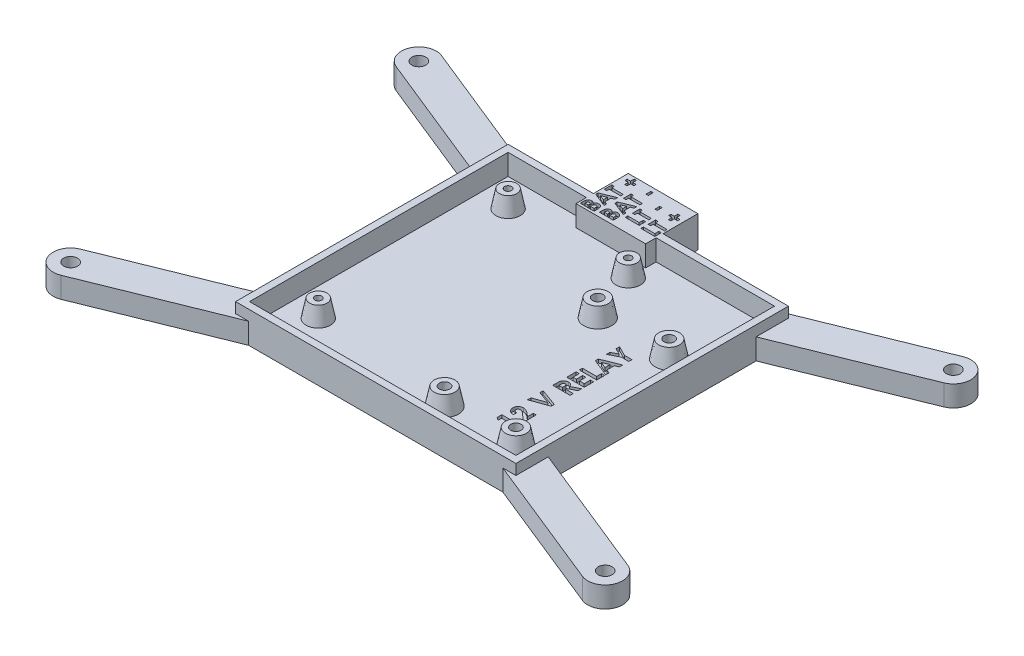
from build123d import *
from build123d.topology import SkipClean

# Parameters (mm, degrees)
SKETCH1_W           = 80.5
SKETCH1_H           = 78.25
SKETCH1_R           = 3
SKETCH1_R_2         = 2.5
SKETCH1_R_3         = 1
SKETCH1_R_4         = 1.5
BOSS_EXTRUDE1_DEPTH = 3
SKETCH1_3_R         = 2.5
SKETCH1_3_R_2       = 1
SKETCH1_3_R_3       = 3
SKETCH1_3_R_4       = 1.5
BOSS_EXTRUDE2_DEPTH = 5
CHAMFER1_SIZE       = 1
CHAMFER1_SIZE_2     = 5
SKETCH2_R           = 5
SKETCH2_R_2         = 2
BOSS_EXTRUDE3_DEPTH = 3
SKETCH3_W           = 80.5
SKETCH3_H           = 78.25
SKETCH3_W_2         = 76.5
SKETCH3_H_2         = 74.25
BOSS_EXTRUDE4_DEPTH = 6
BOSS_EXTRUDE5_START = 3
SKETCH4_R           = 2.5
BOSS_EXTRUDE5_DEPTH = 3
BOSS_EXTRUDE6_REACH = 140.149
SKETCH5_W           = 20
SKETCH5_H           = 15
SKETCH6_W           = 0.666666667
SKETCH6_H           = 1.384615384
SKETCH6_H_2         = 1.384615385
CUT_EXTRUDE1_DEPTH  = 1
CUT_EXTRUDE2_DEPTH  = 1


with BuildPart() as part:
    # Sketch1 → Boss-Extrude1 (new body)
    # profile 1 of 17: a face of its own
    with BuildSketch(Plane(origin=(0, 0, 0), x_dir=(1, 0, 0), z_dir=(0, 1, 0))):
        with Locations((30.25, 25.375)):
            Rectangle(SKETCH1_W, SKETCH1_H)
        with Locations((60.5, 40.25)):
            Circle(SKETCH1_R, mode=Mode.SUBTRACT)
        Circle(SKETCH1_R_2, mode=Mode.SUBTRACT)
        with Locations((34.5, 0)):
            Circle(SKETCH1_R_2, mode=Mode.SUBTRACT)
        with Locations((0, 54.5)):
            Circle(SKETCH1_R_2, mode=Mode.SUBTRACT)
        with Locations((34.5, 54.5)):
            Circle(SKETCH1_R_2, mode=Mode.SUBTRACT)
        with Locations((40, -3.75)):
            Circle(SKETCH1_R, mode=Mode.SUBTRACT)
        with Locations((60.5, -3.75)):
            Circle(SKETCH1_R, mode=Mode.SUBTRACT)
        with Locations((40, 40.25)):
            Circle(SKETCH1_R, mode=Mode.SUBTRACT)
    # profile 2 of 17: a face of its own
    with BuildSketch(Plane(origin=(0, 0, 0), x_dir=(1, 0, 0), z_dir=(0, 1, 0))):
        with Locations((0, 54.5)):
            Circle(SKETCH1_R_2)
        with Locations((0, 54.5)):
            Circle(SKETCH1_R_3, mode=Mode.SUBTRACT)
    # profile 3 of 17: a face of its own
    with BuildSketch(Plane(origin=(0, 0, 0), x_dir=(1, 0, 0), z_dir=(0, 1, 0))):
        with Locations((0, 54.5)):
            Circle(SKETCH1_R_3)
    # profile 4 of 17: a face of its own
    with BuildSketch(Plane(origin=(0, 0, 0), x_dir=(1, 0, 0), z_dir=(0, 1, 0))):
        with Locations((34.5, 54.5)):
            Circle(SKETCH1_R_2)
        with Locations((34.5, 54.5)):
            Circle(SKETCH1_R_3, mode=Mode.SUBTRACT)
    # profile 5 of 17: a face of its own
    with BuildSketch(Plane(origin=(0, 0, 0), x_dir=(1, 0, 0), z_dir=(0, 1, 0))):
        with Locations((34.5, 54.5)):
            Circle(SKETCH1_R_3)
    # profile 6 of 17: a face of its own
    with BuildSketch(Plane(origin=(0, 0, 0), x_dir=(1, 0, 0), z_dir=(0, 1, 0))):
        with Locations((40, 40.25)):
            Circle(SKETCH1_R)
        with Locations((40, 40.25)):
            Circle(SKETCH1_R_4, mode=Mode.SUBTRACT)
    # profile 7 of 17: a face of its own
    with BuildSketch(Plane(origin=(0, 0, 0), x_dir=(1, 0, 0), z_dir=(0, 1, 0))):
        with Locations((40, 40.25)):
            Circle(SKETCH1_R_4)
    # profile 8 of 17: a face of its own
    with BuildSketch(Plane(origin=(0, 0, 0), x_dir=(1, 0, 0), z_dir=(0, 1, 0))):
        with Locations((60.5, 40.25)):
            Circle(SKETCH1_R)
        with Locations((60.5, 40.25)):
            Circle(SKETCH1_R_4, mode=Mode.SUBTRACT)
    # profile 9 of 17: a face of its own
    with BuildSketch(Plane(origin=(0, 0, 0), x_dir=(1, 0, 0), z_dir=(0, 1, 0))):
        with Locations((60.5, 40.25)):
            Circle(SKETCH1_R_4)
    # profile 10 of 17: a face of its own
    with BuildSketch(Plane(origin=(0, 0, 0), x_dir=(1, 0, 0), z_dir=(0, 1, 0))):
        with Locations((60.5, -3.75)):
            Circle(SKETCH1_R)
        with Locations((60.5, -3.75)):
            Circle(SKETCH1_R_4, mode=Mode.SUBTRACT)
    # profile 11 of 17: a face of its own
    with BuildSketch(Plane(origin=(0, 0, 0), x_dir=(1, 0, 0), z_dir=(0, 1, 0))):
        with Locations((60.5, -3.75)):
            Circle(SKETCH1_R_4)
    # profile 12 of 17: a face of its own
    with BuildSketch(Plane(origin=(0, 0, 0), x_dir=(1, 0, 0), z_dir=(0, 1, 0))):
        with Locations((40, -3.75)):
            Circle(SKETCH1_R)
        with Locations((40, -3.75)):
            Circle(SKETCH1_R_4, mode=Mode.SUBTRACT)
    # profile 13 of 17: a face of its own
    with BuildSketch(Plane(origin=(0, 0, 0), x_dir=(1, 0, 0), z_dir=(0, 1, 0))):
        with Locations((40, -3.75)):
            Circle(SKETCH1_R_4)
    # profile 14 of 17: a face of its own
    with BuildSketch(Plane(origin=(0, 0, 0), x_dir=(1, 0, 0), z_dir=(0, 1, 0))):
        with Locations((34.5, 0)):
            Circle(SKETCH1_R_2)
        with Locations((34.5, 0)):
            Circle(SKETCH1_R_3, mode=Mode.SUBTRACT)
    # profile 15 of 17: a face of its own
    with BuildSketch(Plane(origin=(0, 0, 0), x_dir=(1, 0, 0), z_dir=(0, 1, 0))):
        with Locations((34.5, 0)):
            Circle(SKETCH1_R_3)
    # profile 16 of 17: a face of its own
    with BuildSketch(Plane(origin=(0, 0, 0), x_dir=(1, 0, 0), z_dir=(0, 1, 0))):
        Circle(SKETCH1_R_2)
        Circle(SKETCH1_R_3, mode=Mode.SUBTRACT)
    # profile 17 of 17: a face of its own
    with BuildSketch(Plane(origin=(0, 0, 0), x_dir=(1, 0, 0), z_dir=(0, 1, 0))):
        Circle(SKETCH1_R_3)
    extrude(amount=-BOSS_EXTRUDE1_DEPTH)

    # Sketch1<3> → Boss-Extrude2 (add)
    # profile 1 of 7: a face of its own
    with BuildSketch(Plane(origin=(0, 0, 0), x_dir=(1, 0, 0), z_dir=(0, 1, 0))):
        with Locations(Location((0, 0, 0), (0, 0, 270))):
            Circle(SKETCH1_3_R)
        with Locations(Location((0, 0, 0), (0, 0, 270))):
            Circle(SKETCH1_3_R_2, mode=Mode.SUBTRACT)
    # profile 2 of 7: a face of its own
    with BuildSketch(Plane(origin=(0, 0, 0), x_dir=(1, 0, 0), z_dir=(0, 1, 0))):
        with Locations(Location((0, 54.5, 0), (0, 0, 270))):
            Circle(SKETCH1_3_R)
        with Locations(Location((0, 54.5, 0), (0, 0, 270))):
            Circle(SKETCH1_3_R_2, mode=Mode.SUBTRACT)
    # profile 3 of 7: a face of its own
    with BuildSketch(Plane(origin=(0, 0, 0), x_dir=(1, 0, 0), z_dir=(0, 1, 0))):
        with Locations(Location((34.5, 54.5, 0), (0, 0, 270))):
            Circle(SKETCH1_3_R)
        with Locations(Location((34.5, 54.5, 0), (0, 0, 270))):
            Circle(SKETCH1_3_R_2, mode=Mode.SUBTRACT)
    # profile 4 of 7: a face of its own
    with BuildSketch(Plane(origin=(0, 0, 0), x_dir=(1, 0, 0), z_dir=(0, 1, 0))):
        with Locations(Location((40, 40.25, 0), (0, 0, 270))):
            Circle(SKETCH1_3_R_3)
        with Locations(Location((40, 40.25, 0), (0, 0, 270))):
            Circle(SKETCH1_3_R_4, mode=Mode.SUBTRACT)
    # profile 5 of 7: a face of its own
    with BuildSketch(Plane(origin=(0, 0, 0), x_dir=(1, 0, 0), z_dir=(0, 1, 0))):
        with Locations(Location((40, -3.75, 0), (0, 0, 270))):
            Circle(SKETCH1_3_R_3)
        with Locations(Location((40, -3.75, 0), (0, 0, 270))):
            Circle(SKETCH1_3_R_4, mode=Mode.SUBTRACT)
    # profile 6 of 7: a face of its own
    with BuildSketch(Plane(origin=(0, 0, 0), x_dir=(1, 0, 0), z_dir=(0, 1, 0))):
        with Locations(Location((60.5, -3.75, 0), (0, 0, 270))):
            Circle(SKETCH1_3_R_3)
        with Locations(Location((60.5, -3.75, 0), (0, 0, 270))):
            Circle(SKETCH1_3_R_4, mode=Mode.SUBTRACT)
    # profile 7 of 7: a face of its own
    with BuildSketch(Plane(origin=(0, 0, 0), x_dir=(1, 0, 0), z_dir=(0, 1, 0))):
        with Locations(Location((60.5, 40.25, 0), (0, 0, 270))):
            Circle(SKETCH1_3_R_3)
        with Locations(Location((60.5, 40.25, 0), (0, 0, 270))):
            Circle(SKETCH1_3_R_4, mode=Mode.SUBTRACT)
    extrude(amount=BOSS_EXTRUDE2_DEPTH)

    # Chamfer1
    # the kernel refuses this chamfer: 5, 1 mm, written as the material it adds along each edge
    with BuildSketch(Plane(origin=(0, 0, 0), x_dir=(0, 0, 1), z_dir=(-1, 0, 0))) as chamfer1_piece_1_section:
        Polygon((2.5 + CHAMFER1_SIZE, 0), (2.5, CHAMFER1_SIZE_2), (2.5, 0), align=None)
    chamfer1_piece_1 = revolve(axis=Axis((0, 0, 0), (0, 1, 0)), mode=Mode.PRIVATE)
    chamfer1_piece_1 = split(chamfer1_piece_1, bisect_by=Plane(origin=(0, 5, -2.982250848), z_dir=(0, -1, 0)), keep=Keep.TOP, mode=Mode.PRIVATE)
    add(chamfer1_piece_1)
    with BuildSketch(Plane(origin=(0, 0, -54.5), x_dir=(0, 0, 1), z_dir=(-1, 0, 0))) as chamfer1_piece_2_section:
        Polygon((2.5 + CHAMFER1_SIZE, 0), (2.5, CHAMFER1_SIZE_2), (2.5, 0), align=None)
    chamfer1_piece_2 = revolve(axis=Axis((0, 0, -54.5), (0, 1, 0)), mode=Mode.PRIVATE)
    chamfer1_piece_2 = split(chamfer1_piece_2, bisect_by=Plane(origin=(0, 5, -57.482250849), z_dir=(0, -1, 0)), keep=Keep.TOP, mode=Mode.PRIVATE)
    add(chamfer1_piece_2)
    with BuildSketch(Plane(origin=(34.5, 0, -54.5), x_dir=(0, 0, 1), z_dir=(-1, 0, 0))) as chamfer1_piece_3_section:
        Polygon((2.5 + CHAMFER1_SIZE, 0), (2.5, CHAMFER1_SIZE_2), (2.5, 0), align=None)
    chamfer1_piece_3 = revolve(axis=Axis((34.5, 0, -54.5), (0, 1, 0)), mode=Mode.PRIVATE)
    chamfer1_piece_3 = split(chamfer1_piece_3, bisect_by=Plane(origin=(34.5, 5, -57.482250848), z_dir=(0, -1, 0)), keep=Keep.TOP, mode=Mode.PRIVATE)
    add(chamfer1_piece_3)
    with BuildSketch(Plane(origin=(40, 0, -40.25), x_dir=(0, 0, 1), z_dir=(-1, 0, 0))) as chamfer1_piece_4_section:
        Polygon((3 + CHAMFER1_SIZE, 0), (3, CHAMFER1_SIZE_2), (3, 0), align=None)
    chamfer1_piece_4 = revolve(axis=Axis((40, 0, -40.25), (0, 1, 0)), mode=Mode.PRIVATE)
    chamfer1_piece_4 = split(chamfer1_piece_4, bisect_by=Plane(origin=(40, 5, -43.730134063), z_dir=(0, -1, 0)), keep=Keep.TOP, mode=Mode.PRIVATE)
    add(chamfer1_piece_4)
    with BuildSketch(Plane(origin=(40, 0, 3.75), x_dir=(0, 0, 1), z_dir=(-1, 0, 0))) as chamfer1_piece_5_section:
        Polygon((3 + CHAMFER1_SIZE, 0), (3, CHAMFER1_SIZE_2), (3, 0), align=None)
    chamfer1_piece_5 = revolve(axis=Axis((40, 0, 3.75), (0, 1, 0)), mode=Mode.PRIVATE)
    chamfer1_piece_5 = split(chamfer1_piece_5, bisect_by=Plane(origin=(40, 5, 0.269865937), z_dir=(0, -1, 0)), keep=Keep.TOP, mode=Mode.PRIVATE)
    add(chamfer1_piece_5)
    with BuildSketch(Plane(origin=(60.5, 0, 3.75), x_dir=(0, 0, 1), z_dir=(-1, 0, 0))) as chamfer1_piece_6_section:
        Polygon((3 + CHAMFER1_SIZE, 0), (3, CHAMFER1_SIZE_2), (3, 0), align=None)
    chamfer1_piece_6 = revolve(axis=Axis((60.5, 0, 3.75), (0, 1, 0)), mode=Mode.PRIVATE)
    chamfer1_piece_6 = split(chamfer1_piece_6, bisect_by=Plane(origin=(60.5, 5, 0.269865937), z_dir=(0, -1, 0)), keep=Keep.TOP, mode=Mode.PRIVATE)
    add(chamfer1_piece_6)
    with BuildSketch(Plane(origin=(60.5, 0, -40.25), x_dir=(0, 0, 1), z_dir=(-1, 0, 0))) as chamfer1_piece_7_section:
        Polygon((3 + CHAMFER1_SIZE, 0), (3, CHAMFER1_SIZE_2), (3, 0), align=None)
    chamfer1_piece_7 = revolve(axis=Axis((60.5, 0, -40.25), (0, 1, 0)), mode=Mode.PRIVATE)
    chamfer1_piece_7 = split(chamfer1_piece_7, bisect_by=Plane(origin=(60.5, 5, -43.730134062), z_dir=(0, -1, 0)), keep=Keep.TOP, mode=Mode.PRIVATE)
    add(chamfer1_piece_7)



with BuildPart() as body_2:
    # Sketch2 → Boss-Extrude3 (new body)
    # profile 1 of 8: a face of its own
    with BuildSketch(Plane(origin=(0, 0, 0), x_dir=(1, 0, 0), z_dir=(0, 1, 0))):
        with Locations((-46.5, 75.375)):
            Circle(SKETCH2_R)
        with Locations(Location((-46.5, 75.375, 0), (0, 0, 270))):
            Circle(SKETCH2_R_2, mode=Mode.SUBTRACT)
    # profile 2 of 8: a face of its own
    with BuildSketch(Plane(origin=(0, 0, 0), x_dir=(1, 0, 0), z_dir=(0, 1, 0))):
        with BuildLine():
            Line((-6.252552995, 64.5), (-44.626276497, 80.010640219))
            ThreePointArc((-44.626276497, 80.010640219), (-42.354603908, 78.170655781), (-41.5, 75.375))
            ThreePointArc((-41.5, 75.375), (-43.704344219, 71.229603908), (-48.373723503, 70.739359781))
            Line((-48.373723503, 70.739359781), (-10, 55.228719563))
            Line((-10, 55.228719563), (-10, 64.5))
            Line((-10, 64.5), (-6.252552995, 64.5))
        make_face()
    # profile 3 of 8: a face of its own
    with BuildSketch(Plane(origin=(0, 0, 0), x_dir=(1, 0, 0), z_dir=(0, 1, 0))):
        with BuildLine():
            Line((105.126276497, 80.010640219), (66.752552995, 64.5))
            Line((66.752552995, 64.5), (70.5, 64.5))
            Line((70.5, 64.5), (70.5, 55.228719563))
            Line((70.5, 55.228719563), (108.873723503, 70.739359781))
            ThreePointArc((108.873723503, 70.739359781), (102.364359781, 73.501276497), (105.126276497, 80.010640219))
        make_face()
    # profile 4 of 8: a face of its own
    with BuildSketch(Plane(origin=(0, 0, 0), x_dir=(1, 0, 0), z_dir=(0, 1, 0))):
        with BuildLine():
            Line((108.873723503, -19.989359781), (70.5, -4.478719563))
            Line((70.5, -4.478719563), (70.5, -13.75))
            Line((70.5, -13.75), (66.752552995, -13.75))
            Line((66.752552995, -13.75), (105.126276497, -29.260640219))
            ThreePointArc((105.126276497, -29.260640219), (102.364359781, -22.751276497), (108.873723503, -19.989359781))
        make_face()
    # profile 5 of 8: a face of its own
    with BuildSketch(Plane(origin=(0, 0, 0), x_dir=(1, 0, 0), z_dir=(0, 1, 0))):
        with Locations((107, -24.625)):
            Circle(SKETCH2_R)
        with Locations(Location((107, -24.625, 0), (0, 0, 270))):
            Circle(SKETCH2_R_2, mode=Mode.SUBTRACT)
    # profile 6 of 8: a face of its own
    with BuildSketch(Plane(origin=(0, 0, 0), x_dir=(1, 0, 0), z_dir=(0, 1, 0))):
        with Locations((107, 75.375)):
            Circle(SKETCH2_R)
        with Locations(Location((107, 75.375, 0), (0, 0, 270))):
            Circle(SKETCH2_R_2, mode=Mode.SUBTRACT)
    # profile 7 of 8: a face of its own
    with BuildSketch(Plane(origin=(0, 0, 0), x_dir=(1, 0, 0), z_dir=(0, 1, 0))):
        with Locations((-46.5, -24.625)):
            Circle(SKETCH2_R)
        with Locations(Location((-46.5, -24.625, 0), (0, 0, 270))):
            Circle(SKETCH2_R_2, mode=Mode.SUBTRACT)
    # profile 8 of 8: a face of its own
    with BuildSketch(Plane(origin=(0, 0, 0), x_dir=(1, 0, 0), z_dir=(0, 1, 0))):
        with BuildLine():
            Line((-10, -13.75), (-10, -4.478719563))
            Line((-10, -4.478719563), (-48.373723503, -19.989359781))
            ThreePointArc((-48.373723503, -19.989359781), (-43.704344219, -20.479603908), (-41.5, -24.625))
            ThreePointArc((-41.5, -24.625), (-42.354603908, -27.420655781), (-44.626276497, -29.260640219))
            Line((-44.626276497, -29.260640219), (-6.252552995, -13.75))
            Line((-6.252552995, -13.75), (-10, -13.75))
        make_face()
    extrude(amount=BOSS_EXTRUDE3_DEPTH)


with BuildPart() as part_1:
    add(part.part)

    add(body_2.part)  # Boss-Extrude4 merges body 2
    # Sketch3 → Boss-Extrude4 (add)
    with BuildSketch(Plane(origin=(0, 0, 0), x_dir=(1, 0, 0), z_dir=(0, 1, 0))):
        with Locations((30.25, 25.375)):
            Rectangle(SKETCH3_W, SKETCH3_H)
        with Locations((30.25, 25.375)):
            Rectangle(SKETCH3_W_2, SKETCH3_H_2, mode=Mode.SUBTRACT)
    extrude(amount=BOSS_EXTRUDE4_DEPTH)

    # Sketch4 → Boss-Extrude5 (add)
    # profile 1 of 4: a face of its own
    with SkipClean():  # the faces are left unmerged after this step: merging them gives an invalid solid
        with BuildSketch(Plane.XZ.offset(BOSS_EXTRUDE5_START)):
            with BuildLine():
                Line((-6.252552995, 13.75), (-44.626276497, 29.260640219))
                ThreePointArc((-44.626276497, 29.260640219), (-51.135640219, 26.498723503), (-48.373723503, 19.989359781))
                Line((-48.373723503, 19.989359781), (-10, 4.478719563))
                Line((-10, 4.478719563), (-10, 13.75))
                Line((-10, 13.75), (-6.252552995, 13.75))
            make_face()
            with Locations(Location((-46.5, 24.625, 0), (0, 0, 90))):
                Circle(SKETCH4_R, mode=Mode.SUBTRACT)
        # profile 2 of 4: a face of its own
        with BuildSketch(Plane.XZ.offset(BOSS_EXTRUDE5_START)):
            with BuildLine():
                Line((-10, -64.5), (-10, -55.228719563))
                Line((-10, -55.228719563), (-48.373723503, -70.739359781))
                ThreePointArc((-48.373723503, -70.739359781), (-51.135640219, -77.248723503), (-44.626276497, -80.010640219))
                Line((-44.626276497, -80.010640219), (-6.252552995, -64.5))
                Line((-6.252552995, -64.5), (-10, -64.5))
            make_face()
            with Locations(Location((-46.5, -75.375, 0), (0, 0, 90))):
                Circle(SKETCH4_R, mode=Mode.SUBTRACT)
        # profile 3 of 4: a face of its own
        with BuildSketch(Plane.XZ.offset(BOSS_EXTRUDE5_START)):
            with BuildLine():
                Line((108.873723503, -70.739359781), (70.5, -55.228719563))
                Line((70.5, -55.228719563), (70.5, -64.5))
                Line((70.5, -64.5), (66.752552995, -64.5))
                Line((66.752552995, -64.5), (105.126276497, -80.010640219))
                ThreePointArc((105.126276497, -80.010640219), (111.635640219, -77.248723503), (108.873723503, -70.739359781))
            make_face()
            with Locations(Location((107, -75.375, 0), (0, 0, 90))):
                Circle(SKETCH4_R, mode=Mode.SUBTRACT)
        # profile 4 of 4: a face of its own
        with BuildSketch(Plane.XZ.offset(BOSS_EXTRUDE5_START)):
            with BuildLine():
                Line((105.126276497, 29.260640219), (66.752552995, 13.75))
                Line((66.752552995, 13.75), (70.5, 13.75))
                Line((70.5, 13.75), (70.5, 4.478719563))
                Line((70.5, 4.478719563), (108.873723503, 19.989359781))
                ThreePointArc((108.873723503, 19.989359781), (111.635640219, 26.498723503), (105.126276497, 29.260640219))
            make_face()
            with Locations(Location((107, 24.625, 0), (0, 0, 90))):
                Circle(SKETCH4_R, mode=Mode.SUBTRACT)
        extrude(amount=-BOSS_EXTRUDE5_DEPTH)

    # Boss-Extrude6: up to this face of the body (flat: up to its plane)
    boss_extrude6_end = Plane(part_1.part.faces().sort_by_distance((30.25, -3, -25.375))[0])
    # Sketch5 → Boss-Extrude6 (add, up to the picked face)
    with BuildSketch(Plane(origin=(0, 6, 0), x_dir=(1, 0, 0), z_dir=(0, 1, 0)), mode=Mode.PRIVATE) as boss_extrude6_sk1:
        with Locations((24.5, 67)):
            Rectangle(SKETCH5_W, SKETCH5_H)
    boss_extrude6_tool1 = split(extrude(boss_extrude6_sk1.sketch, amount=-BOSS_EXTRUDE6_REACH, mode=Mode.PRIVATE), bisect_by=boss_extrude6_end, keep=Keep.BOTH, mode=Mode.PRIVATE)
    add(boss_extrude6_tool1.solids().sort_by(Axis((24.5, 6, -67), (0, -1, 0)))[0])

    # Sketch6 → Cut-Extrude1 (cut)
    # profile 1 of 14: a face of its own
    with SkipClean():  # the faces are left unmerged after this step: merging them gives an invalid solid
        with BuildSketch(Plane(origin=(0, 6, 0), x_dir=(1, 0, 0), z_dir=(0, 1, 0))):
            Polygon((31.743589744, 69.820512821), (30.769230769, 69.820512821), (30.769230769, 70.487179487), (31.743589744, 70.487179487), (31.743589744, 71.512820513), (32.41025641, 71.512820513), (32.41025641, 70.487179487), (33.384615385, 70.487179487), (33.384615385, 69.820512821), (32.41025641, 69.820512821), (32.41025641, 68.794871795), (31.743589744, 68.794871795), align=None)
        # profile 2 of 14: a face of its own
        with BuildSketch(Plane(origin=(0, 6, 0), x_dir=(1, 0, 0), z_dir=(0, 1, 0))):
            Polygon((30, 64.692307692), (30, 66.846153846), (30.717948718, 66.846153846), (30.717948718, 66.128205128), (34, 66.128205128), (34, 65.41025641), (30.717948718, 65.41025641), (30.717948718, 64.692307692), align=None)
        # profile 3 of 14: a face of its own
        with BuildSketch(Plane(origin=(0, 6, 0), x_dir=(1, 0, 0), z_dir=(0, 1, 0))):
            Polygon((30, 62.641025641), (30, 63.358974359), (33.282051282, 63.358974359), (33.282051282, 64.487179487), (34, 64.487179487), (34, 62.641025641), align=None)
        # profile 4 of 14: a face of its own
        with BuildSketch(Plane(origin=(0, 6, 0), x_dir=(1, 0, 0), z_dir=(0, 1, 0))):
            with Locations((27.538461539, 70.153846154)):
                Rectangle(SKETCH6_W, SKETCH6_H)
        # profile 5 of 14: a face of its own
        with BuildSketch(Plane(origin=(0, 6, 0), x_dir=(1, 0, 0), z_dir=(0, 1, 0))):
            Polygon((25, 65.205128205), (25, 67.358974359), (25.717948718, 67.358974359), (25.717948718, 66.641025641), (29, 66.641025641), (29, 65.923076923), (25.717948718, 65.923076923), (25.717948718, 65.205128205), align=None)
        # profile 6 of 14: a face of its own
        with BuildSketch(Plane(origin=(0, 6, 0), x_dir=(1, 0, 0), z_dir=(0, 1, 0))):
            Polygon((25, 63.153846154), (25, 63.871794872), (28.282051282, 63.871794872), (28.282051282, 65), (29, 65), (29, 63.153846154), align=None)
        # profile 7 of 14: a face of its own
        with BuildSketch(Plane(origin=(0, 6, 0), x_dir=(1, 0, 0), z_dir=(0, 1, 0))):
            with Locations((22.538461539, 72.58974359)):
                Rectangle(SKETCH6_W, SKETCH6_H_2)
        # profile 8 of 14: a face of its own
        with BuildSketch(Plane(origin=(0, 6, 0), x_dir=(1, 0, 0), z_dir=(0, 1, 0))):
            Polygon((20, 67.641025641), (20, 69.794871795), (20.717948718, 69.794871795), (20.717948718, 69.076923077), (24, 69.076923077), (24, 68.358974359), (20.717948718, 68.358974359), (20.717948718, 67.641025641), align=None)
        # profile 9 of 14: a face of its own
        with BuildSketch(Plane(origin=(0, 6, 0), x_dir=(1, 0, 0), z_dir=(0, 1, 0))):
            Polygon((20, 65.180288462), (20, 65.846153846), (24, 67.461538462), (24, 66.694711538), (23.179487179, 66.383814103), (23.179487179, 64.641025641), (24, 64.330128205), (24, 63.564102564), align=None)
            Polygon((21.072916667, 65.512820513), (22.461538462, 64.913461538), (22.461538462, 66.112179487), align=None, mode=Mode.SUBTRACT)
        # profile 10 of 14: a face of its own
        with BuildSketch(Plane(origin=(0, 6, 0), x_dir=(1, 0, 0), z_dir=(0, 1, 0))):
            with BuildLine():
                Line((24, 60.717948718), (20, 60.717948718))
                Line((20, 60.717948718), (20, 61.358974359))
                add(Edge.make_bspline(
                    [(20, 61.358974359), (19.999994879, 61.403850162), (19.999984969, 61.49068399), (20.00438434, 61.615962542), (20.01007542, 61.73214782), (20.016442415, 61.838870075), (20.027414019, 61.936310958), (20.038976892, 62.024322292), (20.052921003, 62.103079926), (20.065429303, 62.151771492), (20.071314103, 62.174679487)],
                    knots=[0, 0, 0, 0, 1.311965854, 2.538629056, 3.664479157, 4.713267157, 5.663616078, 6.530575999, 7.308677837, 8, 8, 8, 8], degree=3))
                add(Edge.make_bspline(
                    [(20.071314103, 62.174679487), (20.079615045, 62.204759749), (20.095904158, 62.263786878), (20.128794769, 62.348337028), (20.165377262, 62.428527448), (20.207029792, 62.504340674), (20.254529279, 62.574879818), (20.306969387, 62.6411128), (20.364369215, 62.702727898), (20.427063746, 62.758756475), (20.493420399, 62.809289539), (20.563400445, 62.853517059), (20.636238713, 62.891246734), (20.712090382, 62.922054978), (20.790860615, 62.945038183), (20.872299844, 62.96189117), (20.956701903, 62.972803414), (21.01412203, 62.973835218), (21.043269231, 62.974358974)],
                    knots=[0, 0, 0, 0, 1.099825721, 2.158211141, 3.195041695, 4.206926465, 5.204905297, 6.190538631, 7.183526201, 8.170733634, 9.152262494, 10.121785545, 11.086538014, 12.041584943, 13.004265891, 13.975982849, 14.972582673, 16, 16, 16, 16], degree=3))
                add(Edge.make_bspline(
                    [(21.043269231, 62.974358974), (21.080717637, 62.972993773), (21.154430222, 62.970306542), (21.26267049, 62.953041281), (21.364855502, 62.921032756), (21.462783517, 62.878120506), (21.557057271, 62.821455594), (21.646505608, 62.748187967), (21.734216807, 62.661019259), (21.786768344, 62.594101538), (21.814102564, 62.559294872)],
                    knots=[0, 0, 0, 0, 0.986208652, 1.941230559, 2.875571179, 3.798165321, 4.751009532, 5.761494368, 6.83566093, 8, 8, 8, 8], degree=3))
                add(Edge.make_bspline(
                    [(21.814102564, 62.559294872), (21.82849789, 62.587498341), (21.856723142, 62.642797542), (21.903143896, 62.72128159), (21.95241686, 62.794041579), (22.003896486, 62.860833342), (22.058355235, 62.922068634), (22.115614203, 62.976769302), (22.17539299, 63.026345193), (22.238103168, 63.069822136), (22.304066375, 63.107299321), (22.372315648, 63.140271429), (22.44345719, 63.168656636), (22.517645319, 63.191722678), (22.594786131, 63.209520865), (22.674701012, 63.220948328), (22.757285614, 63.229741177), (22.813543257, 63.230422707), (22.842147436, 63.230769231)],
                    knots=[0, 0, 0, 0, 1.164539168, 2.28333912, 3.351515688, 4.395009163, 5.383055728, 6.362812631, 7.305003804, 8.237049474, 9.165619381, 10.092784925, 11.02322402, 11.98030579, 12.947919037, 13.931657808, 14.948352129, 16, 16, 16, 16], degree=3))
                add(Edge.make_bspline(
                    [(22.842147436, 63.230769231), (22.896780635, 63.228518049), (23.004599034, 63.224075351), (23.162877628, 63.191513193), (23.312812046, 63.135362678), (23.453612104, 63.059241232), (23.581826481, 62.965915428), (23.69505873, 62.859182182), (23.790197211, 62.738719339), (23.854491487, 62.627913754), (23.897568173, 62.532027369), (23.924323383, 62.452636293), (23.948618954, 62.367218467), (23.967629615, 62.27480448), (23.98175654, 62.176027854), (23.99205974, 62.070954254), (23.998554894, 61.959215312), (23.999508559, 61.882487779), (24, 61.842948718)],
                    knots=[0, 0, 0, 0, 1.284195246, 2.534354168, 3.78027825, 5.036354521, 6.286276797, 7.499025881, 8.683874548, 9.882754589, 10.501292686, 11.152751137, 11.850656415, 12.588451682, 13.369156733, 14.195917516, 15.070324243, 16, 16, 16, 16], degree=3))
                Line((24, 61.842948718), (24, 60.717948718))
            make_face()
            with BuildLine():
                Line((20.717948718, 61.435897436), (21.58974359, 61.435897436))
                Line((21.58974359, 61.435897436), (21.58974359, 61.626602564))
                add(Edge.make_bspline(
                    [(21.58974359, 61.626602564), (21.58951757, 61.652521104), (21.589081253, 61.702555278), (21.583461643, 61.774824334), (21.573874238, 61.842022886), (21.560497397, 61.903896063), (21.543510759, 61.961020236), (21.523072176, 62.01303048), (21.498134882, 62.059698116), (21.460989683, 62.113915115), (21.406328859, 62.171226392), (21.327359974, 62.221676865), (21.236546057, 62.251391857), (21.172497051, 62.254701305), (21.139423077, 62.256410256)],
                    knots=[0, 0, 0, 0, 1.065314748, 2.056525647, 2.977365736, 3.853934255, 4.656397591, 5.425096493, 6.14721249, 6.826394842, 8.123232004, 9.372140726, 10.643011755, 12, 12, 12, 12], degree=3))
                add(Edge.make_bspline(
                    [(21.139423077, 62.256410256), (21.108443727, 62.255042804), (21.048546399, 62.25239889), (20.9644465, 62.222479419), (20.889911799, 62.176010134), (20.838914879, 62.121141654), (20.804047547, 62.069483719), (20.781204377, 62.025217616), (20.760307192, 61.976838049), (20.746211712, 61.922603388), (20.732726598, 61.864252024), (20.7245695, 61.800655254), (20.718534071, 61.732489335), (20.718148021, 61.685378973), (20.717948718, 61.661057692)],
                    knots=[0, 0, 0, 0, 1.348076466, 2.606451671, 3.849585156, 5.153713056, 5.843081946, 6.568636199, 7.327130502, 8.139792284, 9.011860696, 9.942616599, 10.937851541, 12, 12, 12, 12], degree=3))
                Line((20.717948718, 61.661057692), (20.717948718, 61.435897436))
            make_face(mode=Mode.SUBTRACT)
            with BuildLine():
                Line((22.256410256, 61.435897436), (23.282051282, 61.435897436))
                Line((23.282051282, 61.435897436), (23.282051282, 61.642628205))
                add(Edge.make_bspline(
                    [(23.282051282, 61.642628205), (23.281813583, 61.683498136), (23.281356578, 61.762075679), (23.275987792, 61.874653846), (23.266030115, 61.976960078), (23.254404045, 62.069018448), (23.236021308, 62.150075438), (23.216907994, 62.221611424), (23.1923229, 62.282386802), (23.163812997, 62.333438748), (23.13156319, 62.376135427), (23.096660609, 62.413107805), (23.057660587, 62.443945532), (23.015425847, 62.46874593), (22.970346106, 62.48957925), (22.920925007, 62.502341284), (22.86869948, 62.512012386), (22.832581671, 62.512546991), (22.814102564, 62.512820513)],
                    knots=[0, 0, 0, 0, 1.753677247, 3.371663338, 4.833688836, 6.164395063, 7.349095089, 8.3975697, 9.338276771, 10.154261968, 10.899224605, 11.628775934, 12.330426574, 13.024264642, 13.727131073, 14.452891561, 15.208446408, 16, 16, 16, 16], degree=3))
                add(Edge.make_bspline(
                    [(22.814102564, 62.512820513), (22.792970306, 62.512220199), (22.751810353, 62.51105095), (22.691660261, 62.501473196), (22.635469799, 62.484139822), (22.581762046, 62.461982793), (22.532074284, 62.432008513), (22.485650669, 62.395499639), (22.443613579, 62.351804573), (22.40350556, 62.302563412), (22.368097931, 62.245410127), (22.338765881, 62.179383636), (22.312962821, 62.105483472), (22.292768016, 62.022469328), (22.275507943, 61.931083038), (22.265230536, 61.830574613), (22.257576718, 61.721806229), (22.256807912, 61.646383348), (22.256410256, 61.607371795)],
                    knots=[0, 0, 0, 0, 0.844975127, 1.645784239, 2.426462591, 3.192310282, 3.963577212, 4.739343514, 5.547598874, 6.383408773, 7.27567655, 8.226932621, 9.267447238, 10.402227125, 11.640487588, 12.984111775, 14.440069075, 16, 16, 16, 16], degree=3))
                Line((22.256410256, 61.607371795), (22.256410256, 61.435897436))
            make_face(mode=Mode.SUBTRACT)
        # profile 11 of 14: a face of its own
        with BuildSketch(Plane(origin=(0, 6, 0), x_dir=(1, 0, 0), z_dir=(0, 1, 0))):
            Polygon((16.743589744, 72.256410256), (15.769230769, 72.256410256), (15.769230769, 72.923076923), (16.743589744, 72.923076923), (16.743589744, 73.948717949), (17.41025641, 73.948717949), (17.41025641, 72.923076923), (18.384615385, 72.923076923), (18.384615385, 72.256410256), (17.41025641, 72.256410256), (17.41025641, 71.230769231), (16.743589744, 71.230769231), align=None)
        # profile 12 of 14: a face of its own
        with BuildSketch(Plane(origin=(0, 6, 0), x_dir=(1, 0, 0), z_dir=(0, 1, 0))):
            Polygon((15, 67.128205128), (15, 69.282051282), (15.717948718, 69.282051282), (15.717948718, 68.564102564), (19, 68.564102564), (19, 67.846153846), (15.717948718, 67.846153846), (15.717948718, 67.128205128), align=None)
        # profile 13 of 14: a face of its own
        with BuildSketch(Plane(origin=(0, 6, 0), x_dir=(1, 0, 0), z_dir=(0, 1, 0))):
            Polygon((15, 64.667467949), (15, 65.333333333), (19, 66.948717949), (19, 66.181891026), (18.179487179, 65.87099359), (18.179487179, 64.128205128), (19, 63.817307692), (19, 63.051282051), align=None)
            Polygon((16.072916667, 65), (17.461538462, 64.400641026), (17.461538462, 65.599358974), align=None, mode=Mode.SUBTRACT)
        # profile 14 of 14: a face of its own
        with BuildSketch(Plane(origin=(0, 6, 0), x_dir=(1, 0, 0), z_dir=(0, 1, 0))):
            with BuildLine():
                Line((19, 60.205128205), (15, 60.205128205))
                Line((15, 60.205128205), (15, 60.846153846))
                add(Edge.make_bspline(
                    [(15, 60.846153846), (14.999994879, 60.891029649), (14.999984969, 60.977863477), (15.00438434, 61.10314203), (15.01007542, 61.219327307), (15.016442415, 61.326049562), (15.027414019, 61.423490445), (15.038976892, 61.511501779), (15.052921003, 61.590259413), (15.065429303, 61.638950979), (15.071314103, 61.661858974)],
                    knots=[0, 0, 0, 0, 1.311965854, 2.538629056, 3.664479157, 4.713267157, 5.663616078, 6.530575999, 7.308677837, 8, 8, 8, 8], degree=3))
                add(Edge.make_bspline(
                    [(15.071314103, 61.661858974), (15.079615045, 61.691939236), (15.095904158, 61.750966365), (15.128794769, 61.835516515), (15.165377262, 61.915706935), (15.207029792, 61.991520161), (15.254529279, 62.062059305), (15.306969387, 62.128292287), (15.364369215, 62.189907386), (15.427063746, 62.245935962), (15.493420399, 62.296469026), (15.563400445, 62.340696546), (15.636238713, 62.378426221), (15.712090382, 62.409234466), (15.790860615, 62.43221767), (15.872299844, 62.449070657), (15.956701903, 62.459982901), (16.01412203, 62.461014705), (16.043269231, 62.461538462)],
                    knots=[0, 0, 0, 0, 1.099825721, 2.158211141, 3.195041695, 4.206926465, 5.204905297, 6.190538631, 7.183526201, 8.170733634, 9.152262494, 10.121785545, 11.086538014, 12.041584943, 13.004265891, 13.975982849, 14.972582673, 16, 16, 16, 16], degree=3))
                add(Edge.make_bspline(
                    [(16.043269231, 62.461538462), (16.080717637, 62.46017326), (16.154430222, 62.457486029), (16.26267049, 62.440220768), (16.364855502, 62.408212243), (16.462783517, 62.365299994), (16.557057271, 62.308635082), (16.646505608, 62.235367454), (16.734216807, 62.148198747), (16.786768344, 62.081281025), (16.814102564, 62.046474359)],
                    knots=[0, 0, 0, 0, 0.986208652, 1.941230559, 2.875571179, 3.798165321, 4.751009532, 5.761494368, 6.83566093, 8, 8, 8, 8], degree=3))
                add(Edge.make_bspline(
                    [(16.814102564, 62.046474359), (16.82849789, 62.074677828), (16.856723142, 62.129977029), (16.903143896, 62.208461077), (16.95241686, 62.281221066), (17.003896486, 62.348012829), (17.058355235, 62.409248121), (17.115614203, 62.463948789), (17.17539299, 62.51352468), (17.238103168, 62.557001623), (17.304066375, 62.594478808), (17.372315648, 62.627450917), (17.44345719, 62.655836123), (17.517645319, 62.678902165), (17.594786131, 62.696700353), (17.674701012, 62.708127815), (17.757285614, 62.716920665), (17.813543257, 62.717602194), (17.842147436, 62.717948718)],
                    knots=[0, 0, 0, 0, 1.164539168, 2.28333912, 3.351515688, 4.395009163, 5.383055728, 6.362812631, 7.305003804, 8.237049474, 9.165619381, 10.092784925, 11.02322402, 11.98030579, 12.947919037, 13.931657808, 14.948352129, 16, 16, 16, 16], degree=3))
                add(Edge.make_bspline(
                    [(17.842147436, 62.717948718), (17.896780635, 62.715697536), (18.004599034, 62.711254838), (18.162877628, 62.67869268), (18.312812046, 62.622542166), (18.453612104, 62.54642072), (18.581826481, 62.453094915), (18.69505873, 62.346361669), (18.790197211, 62.225898826), (18.854491487, 62.115093241), (18.897568173, 62.019206856), (18.924323383, 61.93981578), (18.948618954, 61.854397954), (18.967629615, 61.761983967), (18.98175654, 61.663207341), (18.99205974, 61.558133741), (18.998554894, 61.446394799), (18.999508559, 61.369667266), (19, 61.330128205)],
                    knots=[0, 0, 0, 0, 1.284195246, 2.534354168, 3.78027825, 5.036354521, 6.286276797, 7.499025881, 8.683874548, 9.882754589, 10.501292686, 11.152751137, 11.850656415, 12.588451682, 13.369156733, 14.195917516, 15.070324243, 16, 16, 16, 16], degree=3))
                Line((19, 61.330128205), (19, 60.205128205))
            make_face()
            with BuildLine():
                Line((15.717948718, 60.923076923), (16.58974359, 60.923076923))
                Line((16.58974359, 60.923076923), (16.58974359, 61.113782051))
                add(Edge.make_bspline(
                    [(16.58974359, 61.113782051), (16.58951757, 61.139700592), (16.589081253, 61.189734765), (16.583461643, 61.262003822), (16.573874238, 61.329202373), (16.560497397, 61.39107555), (16.543510759, 61.448199723), (16.523072176, 61.500209968), (16.498134882, 61.546877603), (16.460989683, 61.601094602), (16.406328859, 61.658405879), (16.327359974, 61.708856352), (16.236546057, 61.738571344), (16.172497051, 61.741880793), (16.139423077, 61.743589744)],
                    knots=[0, 0, 0, 0, 1.065314748, 2.056525647, 2.977365736, 3.853934255, 4.656397591, 5.425096493, 6.14721249, 6.826394842, 8.123232004, 9.372140726, 10.643011755, 12, 12, 12, 12], degree=3))
                add(Edge.make_bspline(
                    [(16.139423077, 61.743589744), (16.108443727, 61.742222291), (16.048546399, 61.739578378), (15.9644465, 61.709658906), (15.889911799, 61.663189621), (15.838914879, 61.608321141), (15.804047547, 61.556663207), (15.781204377, 61.512397103), (15.760307192, 61.464017536), (15.746211712, 61.409782876), (15.732726598, 61.351431512), (15.7245695, 61.287834741), (15.718534071, 61.219668822), (15.718148021, 61.17255846), (15.717948718, 61.148237179)],
                    knots=[0, 0, 0, 0, 1.348076466, 2.606451671, 3.849585156, 5.153713056, 5.843081946, 6.568636199, 7.327130502, 8.139792284, 9.011860696, 9.942616599, 10.937851541, 12, 12, 12, 12], degree=3))
                Line((15.717948718, 61.148237179), (15.717948718, 60.923076923))
            make_face(mode=Mode.SUBTRACT)
            with BuildLine():
                Line((17.256410256, 60.923076923), (18.282051282, 60.923076923))
                Line((18.282051282, 60.923076923), (18.282051282, 61.129807692))
                add(Edge.make_bspline(
                    [(18.282051282, 61.129807692), (18.281813583, 61.170677624), (18.281356578, 61.249255166), (18.275987792, 61.361833333), (18.266030115, 61.464139565), (18.254404045, 61.556197935), (18.236021308, 61.637254926), (18.216907994, 61.708790911), (18.1923229, 61.769566289), (18.163812997, 61.820618235), (18.13156319, 61.863314914), (18.096660609, 61.900287292), (18.057660587, 61.931125019), (18.015425847, 61.955925418), (17.970346106, 61.976758737), (17.920925007, 61.989520772), (17.86869948, 61.999191873), (17.832581671, 61.999726478), (17.814102564, 62)],
                    knots=[0, 0, 0, 0, 1.753677247, 3.371663338, 4.833688836, 6.164395063, 7.349095089, 8.3975697, 9.338276771, 10.154261968, 10.899224605, 11.628775934, 12.330426574, 13.024264642, 13.727131073, 14.452891561, 15.208446408, 16, 16, 16, 16], degree=3))
                add(Edge.make_bspline(
                    [(17.814102564, 62), (17.792970306, 61.999399686), (17.751810353, 61.998230437), (17.691660261, 61.988652683), (17.635469799, 61.97131931), (17.581762046, 61.94916228), (17.532074284, 61.919188), (17.485650669, 61.882679126), (17.443613579, 61.83898406), (17.40350556, 61.789742899), (17.368097931, 61.732589614), (17.338765881, 61.666563123), (17.312962821, 61.592662959), (17.292768016, 61.509648815), (17.275507943, 61.418262525), (17.265230536, 61.3177541), (17.257576718, 61.208985716), (17.256807912, 61.133562835), (17.256410256, 61.094551282)],
                    knots=[0, 0, 0, 0, 0.844975127, 1.645784239, 2.426462591, 3.192310282, 3.963577212, 4.739343514, 5.547598874, 6.383408773, 7.27567655, 8.226932621, 9.267447238, 10.402227125, 11.640487588, 12.984111775, 14.440069075, 16, 16, 16, 16], degree=3))
                Line((17.256410256, 61.094551282), (17.256410256, 60.923076923))
            make_face(mode=Mode.SUBTRACT)
        extrude(amount=-CUT_EXTRUDE1_DEPTH, mode=Mode.SUBTRACT)

    # Sketch7 → Cut-Extrude2 (cut)
    # profile 1 of 8: a face of its own
    with SkipClean():  # the faces are left unmerged after this step: merging them gives an invalid solid
        with BuildSketch(Plane(origin=(0, 0, 0), x_dir=(1, 0, 0), z_dir=(0, 1, 0))):
            Polygon((50.352024341, 32.384615385), (50.352024341, 33.383213141), (52.105830431, 34.275641026), (50.352024341, 35.16806891), (50.352024341, 36.166666667), (53.186559598, 34.724358974), (55.352024341, 34.724358974), (55.352024341, 33.826923077), (53.186559598, 33.826923077), align=None)
        # profile 2 of 8: a face of its own
        with BuildSketch(Plane(origin=(0, 0, 0), x_dir=(1, 0, 0), z_dir=(0, 1, 0))):
            Polygon((50.352024341, 29.212540064), (50.352024341, 30.044871795), (55.352024341, 32.064102564), (55.352024341, 31.10556891), (54.326383316, 30.716947115), (54.326383316, 28.538461538), (55.352024341, 28.149839744), (55.352024341, 27.192307692), align=None)
            Polygon((51.693170174, 29.628205128), (53.428947418, 28.87900641), (53.428947418, 30.377403846), align=None, mode=Mode.SUBTRACT)
        # profile 3 of 8: a face of its own
        with BuildSketch(Plane(origin=(0, 0, 0), x_dir=(1, 0, 0), z_dir=(0, 1, 0))):
            Polygon((50.352024341, 24.596153846), (50.352024341, 25.493589744), (54.454588444, 25.493589744), (54.454588444, 26.903846154), (55.352024341, 26.903846154), (55.352024341, 24.596153846), align=None)
        # profile 4 of 8: a face of its own
        with BuildSketch(Plane(origin=(0, 0, 0), x_dir=(1, 0, 0), z_dir=(0, 1, 0))):
            Polygon((50.352024341, 21.006410256), (50.352024341, 23.698717949), (51.249460239, 23.698717949), (51.249460239, 21.903846154), (52.2109987, 21.903846154), (52.2109987, 23.698717949), (53.108434598, 23.698717949), (53.108434598, 21.903846154), (54.454588444, 21.903846154), (54.454588444, 23.698717949), (55.352024341, 23.698717949), (55.352024341, 21.006410256), align=None)
        # profile 5 of 8: a face of its own
        with BuildSketch(Plane(origin=(0, 0, 0), x_dir=(1, 0, 0), z_dir=(0, 1, 0))):
            with BuildLine():
                Line((50.352024341, 16.967948718), (50.352024341, 18.013621795))
                add(Edge.make_bspline(
                    [(50.352024341, 18.013621795), (50.352266056, 18.082740979), (50.352730943, 18.215676639), (50.360223226, 18.407354408), (50.370422008, 18.583465763), (50.386751049, 18.74409839), (50.406001812, 18.889642456), (50.431095481, 19.019631505), (50.459166067, 19.134474952), (50.494285093, 19.235001205), (50.533836063, 19.325751143), (50.579414923, 19.410245895), (50.630038695, 19.490980327), (50.688984815, 19.565352665), (50.75099379, 19.637711027), (50.820247579, 19.704493275), (50.895543193, 19.766846816), (50.97686559, 19.823645982), (51.062496073, 19.875877974), (51.15274436, 19.920807979), (51.24687635, 19.959115356), (51.344427984, 19.991303084), (51.446372312, 20.01530234), (51.551546786, 20.031735676), (51.660507086, 20.043826755), (51.734534562, 20.044518784), (51.772296777, 20.044871795)],
                    knots=[0, 0, 0, 0, 1.748890285, 3.363608654, 4.853419723, 6.211897754, 7.448506646, 8.566916444, 9.560702549, 10.437053547, 11.257979428, 12.063058964, 12.86458444, 13.665575447, 14.461919362, 15.274455744, 16.096554533, 16.933325211, 17.78237398, 18.632472903, 19.481227396, 20.352186419, 21.229229428, 22.127857616, 23.044999956, 24, 24, 24, 24], degree=3))
                add(Edge.make_bspline(
                    [(51.772296777, 20.044871795), (51.811710554, 20.043948571), (51.888993786, 20.042138298), (52.00253147, 20.032468021), (52.111419757, 20.01448984), (52.214959866, 19.988146627), (52.314212229, 19.956615348), (52.40762777, 19.915779303), (52.496859, 19.869342434), (52.580435469, 19.814253246), (52.660153264, 19.753757478), (52.733117062, 19.683498814), (52.802785643, 19.607447148), (52.866786548, 19.52328818), (52.924721359, 19.431273874), (52.978943306, 19.333134466), (53.028489314, 19.227513671), (53.056202132, 19.153323445), (53.0703737, 19.115384615)],
                    knots=[0, 0, 0, 0, 1.099808295, 2.156523617, 3.176426857, 4.17500812, 5.135317955, 6.078349783, 7.015890908, 7.9382699, 8.868004242, 9.803692517, 10.759882289, 11.743580734, 12.748787378, 13.791075452, 14.870417076, 16, 16, 16, 16], degree=3))
                Line((53.0703737, 19.115384615), (55.352024341, 20.269230769))
                Line((55.352024341, 20.269230769), (55.352024341, 19.271634615))
                Line((55.352024341, 19.271634615), (53.172537162, 18.169871795))
                Line((53.172537162, 18.169871795), (53.172537162, 17.865384615))
                Line((53.172537162, 17.865384615), (55.352024341, 17.865384615))
                Line((55.352024341, 17.865384615), (55.352024341, 16.967948718))
                Line((55.352024341, 16.967948718), (50.352024341, 16.967948718))
            make_face()
            with BuildLine():
                Line((52.275101264, 17.865384615), (52.275101264, 18.21494391))
                add(Edge.make_bspline(
                    [(52.275101264, 18.21494391), (52.274619937, 18.25768044), (52.273698298, 18.339511711), (52.269423355, 18.457195826), (52.259122856, 18.56408107), (52.24610856, 18.660626442), (52.231081676, 18.74731775), (52.209547238, 18.823381739), (52.186472543, 18.889990438), (52.157796683, 18.946354532), (52.125186011, 18.994510719), (52.088139476, 19.036090505), (52.04526283, 19.070482949), (51.997721274, 19.098789685), (51.945094315, 19.120809248), (51.887959677, 19.136881842), (51.825666524, 19.145864045), (51.782675767, 19.146897478), (51.760277546, 19.147435897)],
                    knots=[0, 0, 0, 0, 1.688639943, 3.233382647, 4.650958383, 5.928841754, 7.082724185, 8.122798841, 9.049171256, 9.863274652, 10.613301712, 11.341792392, 12.054588806, 12.776240173, 13.521029143, 14.301969904, 15.115324896, 16, 16, 16, 16], degree=3))
                add(Edge.make_bspline(
                    [(51.760277546, 19.147435897), (51.733764004, 19.146467741), (51.682007064, 19.144577808), (51.607285207, 19.124143452), (51.537625978, 19.093308135), (51.473974823, 19.04966368), (51.418341199, 18.995181799), (51.369194372, 18.93264162), (51.330765191, 18.860415049), (51.30377933, 18.794196091), (51.288631393, 18.733380643), (51.277256523, 18.678684221), (51.268804155, 18.615401085), (51.261962108, 18.543210561), (51.255854685, 18.462750311), (51.251968199, 18.373232079), (51.250256363, 18.275046743), (51.249733254, 18.206597666), (51.249460239, 18.170873397)],
                    knots=[0, 0, 0, 0, 1.020140795, 1.991411262, 2.965409065, 3.947543434, 4.949233831, 5.95883764, 7.001880521, 8.094604842, 8.706727239, 9.41631554, 10.248493651, 11.167128553, 12.212949395, 13.360078347, 14.622198054, 16, 16, 16, 16], degree=3))
                Line((51.249460239, 18.170873397), (51.249460239, 17.865384615))
                Line((51.249460239, 17.865384615), (52.275101264, 17.865384615))
            make_face(mode=Mode.SUBTRACT)
        # profile 6 of 8: a face of its own
        with BuildSketch(Plane(origin=(0, 0, 0), x_dir=(1, 0, 0), z_dir=(0, 1, 0))):
            Polygon((50.352024341, 9.756410256), (50.352024341, 10.71494391), (53.903707033, 12), (50.352024341, 13.288060897), (50.352024341, 14.243589744), (55.352024341, 12.430689103), (55.352024341, 11.56630609), align=None)
        # profile 7 of 8: a face of its own
        with BuildSketch(Plane(origin=(0, 0, 0), x_dir=(1, 0, 0), z_dir=(0, 1, 0))):
            with BuildLine():
                Line((52.018691008, 4.916666667), (52.018691008, 4.019230769))
                add(Edge.make_bspline(
                    [(52.018691008, 4.019230769), (51.95080402, 4.023105135), (51.818156921, 4.030675415), (51.625494676, 4.0608211), (51.443405496, 4.101111491), (51.272436814, 4.155343352), (51.112516801, 4.222142055), (50.964175182, 4.303170143), (50.82634902, 4.396008405), (50.701455512, 4.502528172), (50.58917245, 4.618406321), (50.49101165, 4.743345781), (50.408838223, 4.876991644), (50.341430985, 5.01845025), (50.287496514, 5.167165968), (50.251455939, 5.324641358), (50.227043628, 5.489486906), (50.224907798, 5.602338033), (50.223819213, 5.659855769)],
                    knots=[0, 0, 0, 0, 1.198928049, 2.342633425, 3.435730849, 4.486331048, 5.502589352, 6.488331875, 7.46361919, 8.428949135, 9.378681775, 10.305958057, 11.226249248, 12.140413166, 13.066341608, 14.010670971, 14.986082777, 16, 16, 16, 16], degree=3))
                add(Edge.make_bspline(
                    [(50.223819213, 5.659855769), (50.225874096, 5.730489679), (50.229887472, 5.868444214), (50.268647191, 6.068236795), (50.328001349, 6.25583061), (50.414234753, 6.429230193), (50.522975773, 6.588134069), (50.652884045, 6.731658783), (50.805537733, 6.857005148), (50.976540798, 6.963195605), (51.157970623, 7.051009519), (51.345233956, 7.113136439), (51.533497614, 7.153756631), (51.660249826, 7.158099128), (51.723218251, 7.16025641)],
                    knots=[0, 0, 0, 0, 1.075374184, 2.100304875, 3.089917907, 4.066149699, 5.039978333, 6.01615708, 7.006437042, 8.039858286, 9.077679641, 10.07047942, 11.041445745, 12, 12, 12, 12], degree=3))
                add(Edge.make_bspline(
                    [(51.723218251, 7.16025641), (51.76130674, 7.159417556), (51.837969459, 7.157729149), (51.953978969, 7.145989435), (52.072148215, 7.128377538), (52.192375894, 7.101823111), (52.314695645, 7.068707486), (52.439473774, 7.028533746), (52.566001869, 6.980368598), (52.695707797, 6.925021385), (52.828997366, 6.858973383), (52.967931726, 6.782146312), (53.112362971, 6.691971668), (53.263707767, 6.591384908), (53.419655254, 6.476428923), (53.581937106, 6.350148789), (53.750297612, 6.211908843), (53.862888145, 6.113870957), (53.920734277, 6.063501603)],
                    knots=[0, 0, 0, 0, 0.728277616, 1.465842947, 2.227925269, 3.011838508, 3.818735656, 4.650581052, 5.517389122, 6.406849312, 7.346234817, 8.360743166, 9.441530624, 10.601362564, 11.834937575, 13.145232671, 14.533293658, 16, 16, 16, 16], degree=3))
                Line((53.920734277, 6.063501603), (54.518691008, 5.541666667))
                Line((54.518691008, 5.541666667), (54.518691008, 7.224358974))
                Line((54.518691008, 7.224358974), (55.352024341, 7.224358974))
                Line((55.352024341, 7.224358974), (55.352024341, 3.891025641))
                Line((55.352024341, 3.891025641), (54.897296777, 3.891025641))
                Line((54.897296777, 3.891025641), (53.321775944, 5.371394231))
                add(Edge.make_bspline(
                    [(53.321775944, 5.371394231), (53.275817969, 5.414255384), (53.186811001, 5.497264728), (53.056087332, 5.615367447), (52.932060466, 5.722279307), (52.813292105, 5.815609774), (52.703803588, 5.901005607), (52.599455833, 5.972445503), (52.503187456, 6.034660899), (52.385840133, 6.099651453), (52.246939632, 6.162791496), (52.087019459, 6.220689909), (51.934065424, 6.255629219), (51.83421885, 6.26048908), (51.786319213, 6.262820513)],
                    knots=[0, 0, 0, 0, 1.246192343, 2.413505005, 3.49357156, 4.492416076, 5.408771964, 6.246246772, 6.999304986, 7.680960093, 8.904522682, 10.020616941, 11.0504258, 12, 12, 12, 12], degree=3))
                add(Edge.make_bspline(
                    [(51.786319213, 6.262820513), (51.739978354, 6.261081957), (51.650185509, 6.257713226), (51.522455666, 6.220693608), (51.406809332, 6.16334153), (51.30670215, 6.082524352), (51.22443744, 5.984629439), (51.163251261, 5.871502671), (51.127947115, 5.744066364), (51.123528298, 5.654731085), (51.12125511, 5.608774038)],
                    knots=[0, 0, 0, 0, 1.062038974, 2.057870785, 3.028805853, 4.01125022, 4.991535629, 5.949134679, 6.94496649, 8, 8, 8, 8], degree=3))
                add(Edge.make_bspline(
                    [(51.12125511, 5.608774038), (51.122094853, 5.585032043), (51.123748021, 5.538292112), (51.134752714, 5.469588066), (51.154147336, 5.40421123), (51.180133401, 5.341433925), (51.214578116, 5.281926124), (51.257036715, 5.225837927), (51.306430228, 5.172578373), (51.362604209, 5.122391732), (51.425294388, 5.076715337), (51.493928219, 5.03614573), (51.568463099, 5.002601418), (51.647915052, 4.973067787), (51.733137459, 4.950290038), (51.823620273, 4.933705011), (51.919216289, 4.921096522), (51.984929561, 4.918170147), (52.018691008, 4.916666667)],
                    knots=[0, 0, 0, 0, 0.903469896, 1.778625579, 2.63899355, 3.493148037, 4.358286772, 5.247621495, 6.164656832, 7.118446693, 8.109501108, 9.111810964, 10.146451449, 11.215617525, 12.33435995, 13.498009769, 14.714554818, 16, 16, 16, 16], degree=3))
            make_face()
        # profile 8 of 8: a face of its own
        with BuildSketch(Plane(origin=(0, 0, 0), x_dir=(1, 0, 0), z_dir=(0, 1, 0))):
            Polygon((50.352024341, 0.965344551), (50.352024341, 2.352564103), (55.352024341, 2.352564103), (55.352024341, 1.455128205), (51.185357674, 1.455128205), (51.185357674, 0.429487179), align=None)
        extrude(amount=-CUT_EXTRUDE2_DEPTH, mode=Mode.SUBTRACT)


solid = part_1.part
